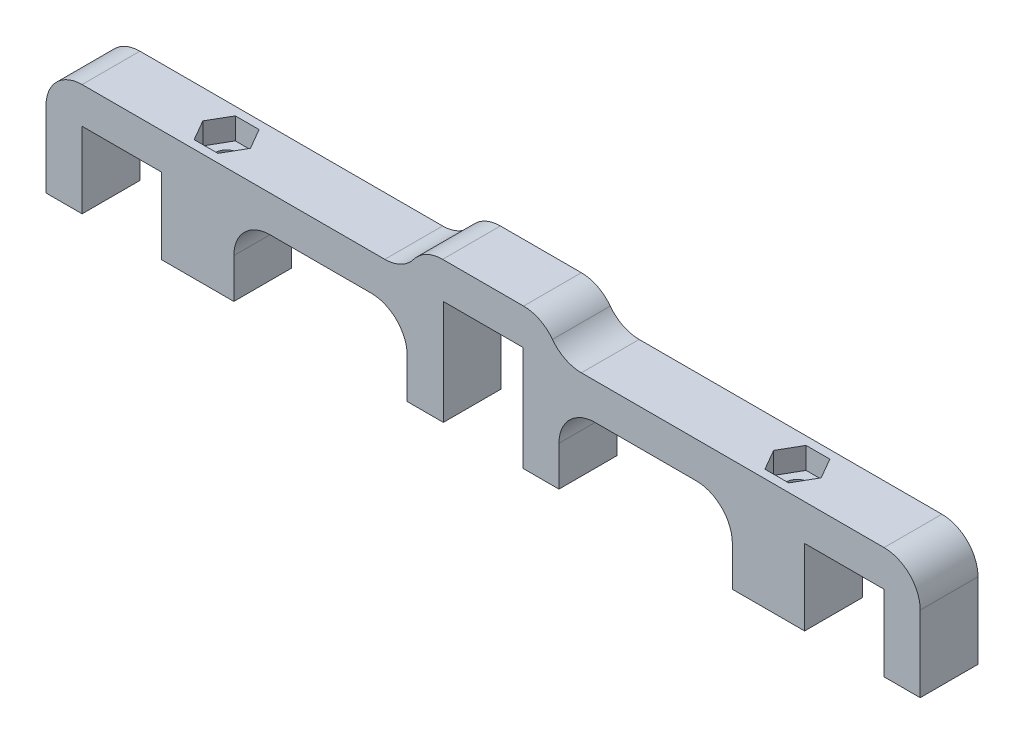
from build123d import *

# Parameters (mm, degrees)
BOSS_EXTRU_1_DEPTH      = 8
ENL_V_MAT_EXTRU_1_REACH = 124.251
ESQUISSE2_R             = 1.65
CONG_1_R                = 5
ENL_V_MAT_EXTRU_2_DEPTH = 3
CONG_2_R                = 5
CONG_3_R                = 5
CONG_4_R                = 5


with BuildPart() as part:
    # Esquisse1 → Boss.-Extru.1 (new body)
    with BuildSketch(Plane.XY):
        Polygon((0, 10.5), (0, 15.5), (50, 15.5), (50, 19.5), (71, 19.5), (71, 15.5), (121, 15.5), (121, 10.5), (121, 0), (116, 0), (116, 10.5), (105, 10.5), (105, 0), (95, 0), (95, 10.5), (71, 10.5), (71, 0), (66, 0), (66, 10.5), (66, 14.5), (55, 14.5), (55, 10.5), (55, 0), (50, 0), (50, 10.5), (26, 10.5), (26, 0), (16, 0), (16, 10.5), (5, 10.5), (5, 0), (0, 0), align=None)
    extrude(amount=BOSS_EXTRU_1_DEPTH)

    # Esquisse2 → Enlèv. mat.-Extru.1 (cut, up to next)
    with BuildSketch(Plane(origin=(0, 15.5, 0), x_dir=(1, 0, 0), z_dir=(0, 1, 0)), mode=Mode.PRIVATE) as enl_v_mat_extru_1_sk1:
        with Locations(Location((21, -4, 0), (0, 0, 270))):
            Circle(ESQUISSE2_R)
    enl_v_mat_extru_1_tool1 = extrude(enl_v_mat_extru_1_sk1.sketch, amount=-ENL_V_MAT_EXTRU_1_REACH, mode=Mode.PRIVATE) & part.part
    # Esquisse2 → Enlèv. mat.-Extru.1 (cut, up to next)
    with BuildSketch(Plane(origin=(0, 15.5, 0), x_dir=(1, 0, 0), z_dir=(0, 1, 0)), mode=Mode.PRIVATE) as enl_v_mat_extru_1_sk2:
        with Locations(Location((100, -4, 0), (0, 0, 270))):
            Circle(ESQUISSE2_R)
    enl_v_mat_extru_1_tool2 = extrude(enl_v_mat_extru_1_sk2.sketch, amount=-ENL_V_MAT_EXTRU_1_REACH, mode=Mode.PRIVATE) & part.part
    add(enl_v_mat_extru_1_tool1.solids().sort_by_distance((21, 15.5, 4))[0], mode=Mode.SUBTRACT)
    add(enl_v_mat_extru_1_tool2.solids().sort_by_distance((100, 15.5, 4))[0], mode=Mode.SUBTRACT)

    # Congé1
    # the kernel refuses this fillet: 5 mm, written as the material it takes off along each edge
    with BuildSketch(Plane(origin=(50, 19.5, -12.247448714), x_dir=(1.568523089189919e-12, -1.0, 0), z_dir=(0, 0, 1))) as cong_1_piece_1:
        with BuildLine():
            CenterArc((5, 4.898979486), CONG_1_R, 180, 78.463040967)
            Line((0, 4.898979486), (-0.1, 4.898979486))
            Line((-0.1, 4.898979486), (-0.1, 0))
            Line((-0.1, 0), (0, -0.1))
            ThreePointArc((0, -0.1), (2, -0.1), (3.98, -0.09797959))
            Line((3.98, -0.09797959), (4, 0))
        make_face()
    extrude(amount=32.494897428, mode=Mode.SUBTRACT)
    with BuildSketch(Plane(origin=(71, 19.5, -12.247448714), x_dir=(-1, 0, 0), z_dir=(0, 0, 1))) as cong_1_piece_2:
        with BuildLine():
            CenterArc((4.898979486, 5), CONG_1_R, 191.536959033, 78.463040967)
            Line((0, 4), (-0.09797959, 3.98))
            ThreePointArc((-0.09797959, 3.98), (-0.1, 2), (-0.1, 0))
            Line((-0.1, 0), (0, -0.1))
            Line((0, -0.1), (4.898979486, -0.1))
            Line((4.898979486, -0.1), (4.898979486, 0))
        make_face()
    extrude(amount=32.494897428, mode=Mode.SUBTRACT)

    # Esquisse3 → Enlèv. mat.-Extru.2 (cut)
    with BuildSketch(Plane(origin=(0, 15.5, 0), x_dir=(1, 0, 0), z_dir=(0, 1, 0))):
        Polygon((19.354551733, -1.15), (22.645448267, -1.15), (24.290896534, -4), (22.645448267, -6.85), (19.354551733, -6.85), (17.709103466, -4), align=None)
        Polygon((103.290896534, -4), (101.645448267, -1.15), (98.354551733, -1.15), (96.709103466, -4), (98.354551733, -6.85), (101.645448267, -6.85), align=None)
    extrude(amount=-ENL_V_MAT_EXTRU_2_DEPTH, mode=Mode.SUBTRACT)

    # Congé2
    cong_2_edges = [part.edges().sort_by_distance(p)[0] for p in [
        (0, 15.5, 4),
        (121, 15.5, 4),
    ]]
    fillet(cong_2_edges, radius=CONG_2_R)

    # Congé3
    cong_3_edges = [part.edges().sort_by_distance(p)[0] for p in [
        (95, 10.5, 4),
        (71, 10.5, 4),
        (50, 10.5, 4),
        (26, 10.5, 4),
    ]]
    fillet(cong_3_edges, radius=CONG_3_R)

    # Congé4
    cong_4_edges = [part.edges().sort_by_distance(p)[0] for p in [
        (50, 15.5, 4),
        (71, 15.5, 4),
    ]]
    fillet(cong_4_edges, radius=CONG_4_R)


solid = part.part
